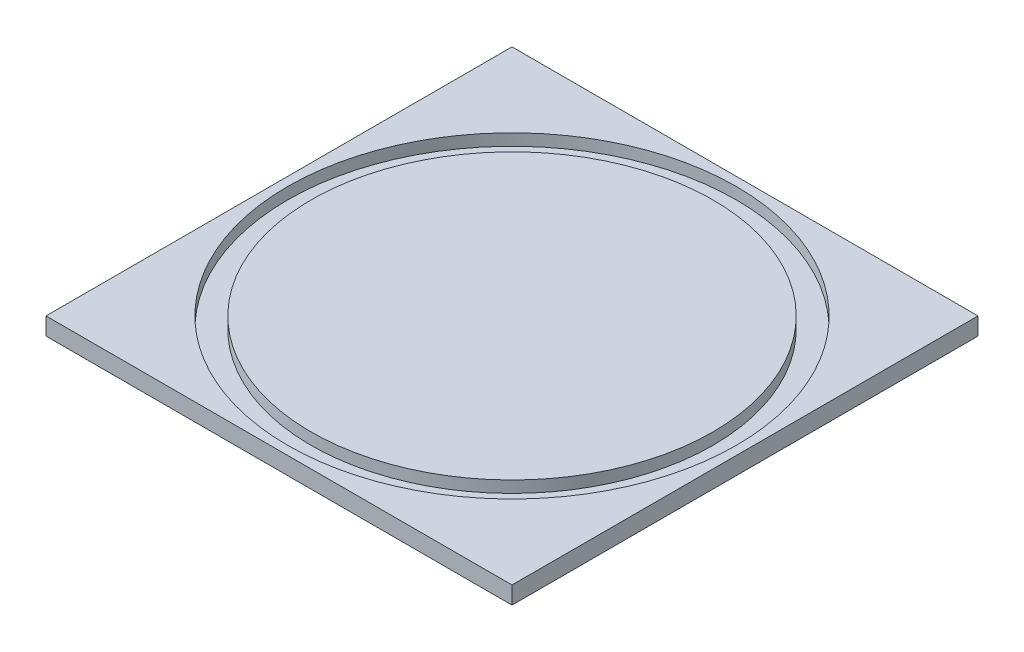
from build123d import *

# Parameters (mm, degrees)
SKETCH1_W               = 80
SKETCH1_H               = 80
BOSS_EXTRUDE1_DEPTH     = 3
SKETCH3_R               = 38.5
SKETCH3_R_2             = 34.5
CUT_EXTRUDE_THIN1_DEPTH = 2


with BuildPart() as part:
    # Sketch1 → Boss-Extrude1 (new body)
    with BuildSketch(Plane(origin=(0, 0, 0), x_dir=(1, 0, 0), z_dir=(0, 1, 0))):
        with Locations((40, 0)):
            Rectangle(SKETCH1_W, SKETCH1_H)
    extrude(amount=BOSS_EXTRUDE1_DEPTH)

    # Sketch3 → Cut-Extrude-Thin1 (cut)
    with BuildSketch(Plane(origin=(0, 3, 0), x_dir=(1, 0, 0), z_dir=(0, 1, 0))):
        with Locations((40, 0)):
            Circle(SKETCH3_R)
        with Locations((40, 0)):
            Circle(SKETCH3_R_2, mode=Mode.SUBTRACT)
    extrude(amount=-CUT_EXTRUDE_THIN1_DEPTH, mode=Mode.SUBTRACT)


solid = part.part
